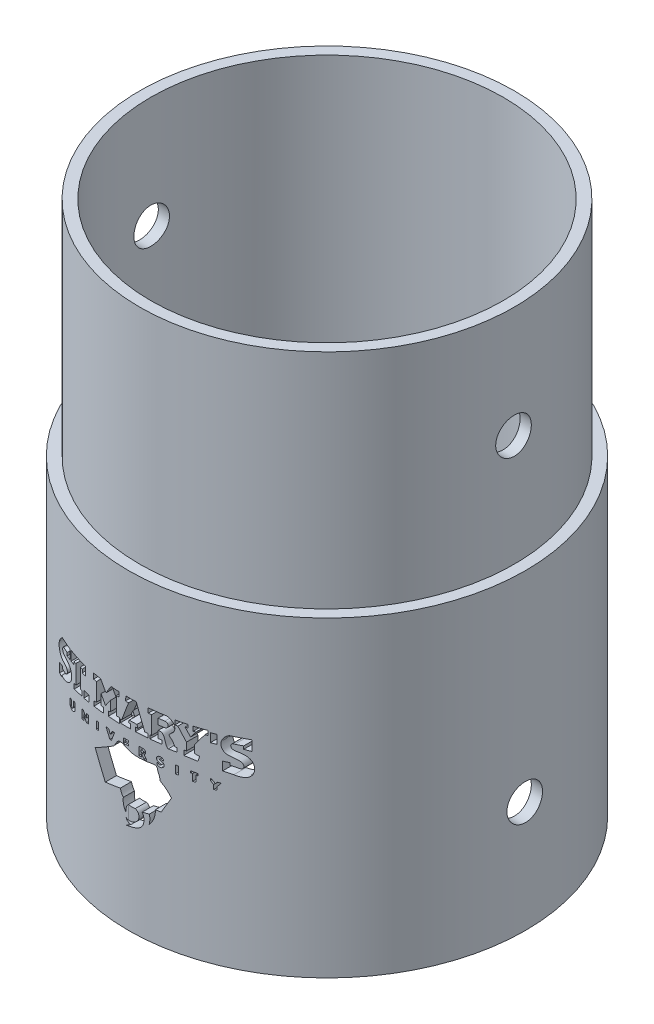
from build123d import *

# Parameters (mm, degrees)
SKETCH1_R               = 34
BOSS_EXTRUDE1_DEPTH     = 10
SKETCH2_R               = 19.7871926
SKETCH2_R_2             = 2
CUT_EXTRUDE1_DEPTH      = 10
SKETCH3_R               = 4.837531333
SKETCH4_W               = 4.837531333
SKETCH4_H               = 4.837531333
CUT_EXTRUDE3_DEPTH      = 38
CUT_EXTRUDE3_DEPTH_BACK = 38
SKETCH5_W               = 72.361656805
SKETCH5_H               = 8.896778435
BOSS_EXTRUDE2_START     = 60
SKETCH6_R               = 22.2871926
SKETCH6_R_2             = 19.7871926
BOSS_EXTRUDE2_DEPTH     = 60
SKETCH7_R               = 21.0371926
SKETCH7_R_2             = 19.7871926
CUT_EXTRUDE4_DEPTH      = 25
CUT_EXTRUDE6_DEPTH      = 25
CUT_EXTRUDE6_DEPTH_BACK = 25
SKETCH8_R               = 2
CUT_EXTRUDE7_DEPTH      = 43
CUT_EXTRUDE7_DEPTH_BACK = 53
SKETCH9_W               = 69.351432881
SKETCH9_H               = 5.737807944
CUT_EXTRUDE8_START      = -25
SKETCH10_R              = 22.2871926
SKETCH10_R_2            = 21.0371926
CUT_EXTRUDE8_DEPTH      = 25
CUT_EXTRUDE9_DEPTH      = 30
CUT_EXTRUDE9_DEPTH_BACK = 30
SKETCH11_R              = 2
SKETCH13_W              = 0.263768511
SKETCH13_H              = 0.832043755
SKETCH13_W_2            = 0.284163404
SKETCH13_H_2            = 0.878419158
SKETCH13_W_3            = 0.554118638
SKETCH13_H_3            = 0.980849503
CUT_EXTRUDE10_DEPTH     = 10


with BuildPart() as part:
    # Sketch1 → Boss-Extrude1 (new body)
    with BuildSketch(Plane(origin=(0, 0, 0), x_dir=(1, 0, 0), z_dir=(0, 1, 0))):
        Circle(SKETCH1_R)
    extrude(amount=BOSS_EXTRUDE1_DEPTH)

    # Sketch2 → Cut-Extrude1 (cut)
    with BuildSketch(Plane.XZ):
        Circle(SKETCH2_R)
        with Locations((-22.1, 12.5)):
            Circle(SKETCH2_R_2)
        with Locations((22.1, 12.5)):
            Circle(SKETCH2_R_2)
        with Locations((22.1, -12.5)):
            Circle(SKETCH2_R_2)
        with Locations((-22.1, -12.5)):
            Circle(SKETCH2_R_2)
    extrude(amount=-CUT_EXTRUDE1_DEPTH, mode=Mode.SUBTRACT)

    # Sketch3 → Cut-Revolve1 (revolve, cut)
    with BuildSketch(Plane(origin=(0, 0, 0), x_dir=(0, 0, -1), z_dir=(1, 0, 0))):
        with Locations((-34, 5)):
            Circle(SKETCH3_R)
    revolve(axis=Axis((0, 0, 0), (0, 1, 0)), mode=Mode.SUBTRACT)

    # Sketch4 → Cut-Revolve2 (revolve, cut)
    with BuildSketch(Plane(origin=(0, 0, 0), x_dir=(0, 0, -1), z_dir=(1, 0, 0))):
        with Locations((-31.581234333, 2.581234333)):
            Rectangle(SKETCH4_W, SKETCH4_H)
    revolve(axis=Axis((0, 0, 0), (0, 1, 0)), mode=Mode.SUBTRACT)

    # Sketch5 → Cut-Extrude3 (cut, two sides: drawn at the far end of the back side and taken through both)
    with BuildSketch(Plane(origin=(0, 0, 0), x_dir=(0, 0, -1), z_dir=(1, 0, 0)).offset(-CUT_EXTRUDE3_DEPTH_BACK)):
        with Locations((-0.901301775, 0.551610782)):
            Rectangle(SKETCH5_W, SKETCH5_H)
    extrude(amount=CUT_EXTRUDE3_DEPTH + CUT_EXTRUDE3_DEPTH_BACK, mode=Mode.SUBTRACT)

    # Sketch6 → Boss-Extrude2 (add)
    with BuildSketch(Plane.XZ.offset(-5).offset(BOSS_EXTRUDE2_START)):
        Circle(SKETCH6_R)
        Circle(SKETCH6_R_2, mode=Mode.SUBTRACT)
    extrude(amount=-BOSS_EXTRUDE2_DEPTH)

    # Sketch7 → Cut-Extrude4 (cut)
    with BuildSketch(Plane.XZ.offset(55)):
        Circle(SKETCH7_R)
        Circle(SKETCH7_R_2, mode=Mode.SUBTRACT)
    extrude(amount=-CUT_EXTRUDE4_DEPTH, mode=Mode.SUBTRACT)

    # Sketch8 → Cut-Extrude6 (cut, two sides: drawn at the far end of the back side and taken through both)
    with BuildSketch(Plane(origin=(0, 0, 0), x_dir=(0, 0, -1), z_dir=(1, 0, 0)).offset(-CUT_EXTRUDE6_DEPTH_BACK)):
        with Locations((0, -42.5)):
            Circle(SKETCH8_R)
    extrude(amount=CUT_EXTRUDE6_DEPTH + CUT_EXTRUDE6_DEPTH_BACK, mode=Mode.SUBTRACT)

    # Sketch9 → Cut-Extrude7 (cut, two sides: drawn at the far end of the back side and taken through both)
    with BuildSketch(Plane(origin=(0, 0, 0), x_dir=(0, 0, -1), z_dir=(1, 0, 0)).offset(-CUT_EXTRUDE7_DEPTH_BACK)):
        with Locations((0.165912519, 7.868903972)):
            Rectangle(SKETCH9_W, SKETCH9_H)
    extrude(amount=CUT_EXTRUDE7_DEPTH + CUT_EXTRUDE7_DEPTH_BACK, mode=Mode.SUBTRACT)

    # Sketch10 → Cut-Extrude8 (cut)
    with BuildSketch(Plane(origin=(0, 5, 0), x_dir=(1, 0, 0), z_dir=(0, 1, 0)).offset(CUT_EXTRUDE8_START)):
        Circle(SKETCH10_R)
        Circle(SKETCH10_R_2, mode=Mode.SUBTRACT)
    extrude(amount=CUT_EXTRUDE8_DEPTH, mode=Mode.SUBTRACT)

    # Sketch11 → Cut-Extrude9 (cut, two sides: drawn at the far end of the back side and taken through both)
    with BuildSketch(Plane(origin=(0, 0, 0), x_dir=(0, 0, -1), z_dir=(1, 0, 0)).offset(-CUT_EXTRUDE9_DEPTH_BACK)):
        with Locations((0, -7.5)):
            Circle(SKETCH11_R)
    extrude(amount=CUT_EXTRUDE9_DEPTH + CUT_EXTRUDE9_DEPTH_BACK, mode=Mode.SUBTRACT)

    # Sketch13 → Cut-Extrude10 (cut)
    # profile 1 of 20: a face of its own
    with BuildSketch(Plane.XY.offset(22.2871926)):
        with BuildLine():
            Line((2.836361609, -41.920982841), (3.402422545, -41.91240616))
            Line((3.402422545, -41.91240616), (4.388740843, -40.154186586))
            add(Edge.make_bspline(
                [(4.388740843, -40.154186586), (3.953248153, -39.424133031), (3.282349013, -38.901991183)],
                knots=[0, 0, 0, 1, 1, 1], degree=2))
            add(Edge.make_bspline(
                [(3.282349013, -38.901991183), (3.278682525, -38.462975575), (3.071517485, -38.069687572)],
                knots=[0, 0, 0, 1, 1, 1], degree=2))
            add(Edge.make_bspline(
                [(-1.818298439, -38.006885508), (-1.548063892, -37.870643869), (-1.380953645, -37.081194053), (-0.679356744, -37.120843751), (-0.264912136, -37.339278705), (0.406742784, -37.598482622), (1.294786113, -37.673169888), (2.272663425, -37.634020046), (3.079278305, -37.482676425), (3.071517485, -38.069687572)],
                knots=[0, 0, 0, 0, 0.207613915, 0.255303168, 0.349193661, 0.455828664, 0.635269324, 0.809737725, 1, 1, 1, 1], degree=3))
            add(Edge.make_bspline(
                [(-4.122918881, -39.477452838), (-2.967006362, -38.747814904), (-1.818298439, -38.006885508)],
                knots=[0, 0, 0, 1, 1, 1], degree=2))
            Line((-4.122918881, -39.477452838), (-2.784044148, -42.045458474))
            Line((-2.784044148, -42.045458474), (-0.940347794, -41.628431918))
            add(Edge.make_bspline(
                [(-0.940347794, -41.628431918), (-0.819931819, -42.073859012), (-0.591539569, -42.349081415)],
                knots=[0, 0, 0, 0.333862906, 0.333862906, 0.333862906], degree=2))
            add(Edge.make_bspline(
                [(-0.591539569, -42.349081415), (-0.690661576, -43.074522796), (-0.28188481, -43.644895691)],
                knots=[0, 0, 0, 1, 1, 1], degree=2))
            add(Edge.make_bspline(
                [(0.001826697, -42.737888696), (-0.384406173, -43.126300945), (-0.28188481, -43.644895691)],
                knots=[0, 0, 0, 1, 1, 1], degree=2))
            add(Edge.make_bspline(
                [(0.001826697, -42.737888696), (0.326733886, -42.831120176), (0.749707197, -42.769767756)],
                knots=[0.681826442, 0.681826442, 0.681826442, 1, 1, 1], degree=2))
            add(Edge.make_bspline(
                [(0.749707197, -42.769767756), (1.271104248, -43.027328851), (1.195747805, -43.825293152), (0.416905383, -44.29959265), (-0.043033159, -44.290900484), (-0.28188481, -44.145481691)],
                knots=[0, 0, 0, 0, 0.500944797, 0.699688043, 1, 1, 1, 1], degree=3))
            add(Edge.make_bspline(
                [(-0.28188481, -44.145481691), (-0.107271874, -44.518653759), (0.284429083, -44.54759516)],
                knots=[0, 0, 0, 1, 1, 1], degree=2))
            add(Edge.make_bspline(
                [(0.284429083, -44.54759516), (0.001576931, -44.722339623), (-0.28188481, -44.896093499)],
                knots=[0, 0, 0, 1, 1, 1], degree=2))
            add(Edge.make_bspline(
                [(-0.28188481, -44.896093499), (0.248184768, -44.7593563), (1.703383303, -44.62885333), (1.756900471, -43.176386467), (1.481246036, -42.769767756)],
                knots=[0, 0, 0, 0, 0.551984151, 1, 1, 1, 1], degree=3))
            Line((1.481246036, -42.769767756), (2.227417269, -42.616126394))
            add(Edge.make_bspline(
                [(2.227417269, -42.616126394), (2.34194184, -43.131829254), (2.201687227, -43.644895691)],
                knots=[0, 0, 0, 1, 1, 1], degree=2))
            add(Edge.make_bspline(
                [(2.836361609, -41.920982841), (2.85849956, -42.909529006), (2.201687227, -43.644895691)],
                knots=[0, 0, 0, 1, 1, 1], degree=2))
        make_face()
    # profile 2 of 20: a face of its own
    with BuildSketch(Plane.XY.offset(22.2871926)):
        with BuildLine():
            add(Edge.make_bspline(
                [(-8.050906857, -37.883629276), (-7.641193205, -38.401338737), (-7.206196559, -37.864857937)],
                knots=[0, 0, 0, 1, 1, 1], degree=2))
            Line((-7.206196559, -37.864857937), (-7.206196559, -37.038918979))
            Line((-7.206196559, -37.038918979), (-7.497152328, -37.038918979))
            Line((-7.497152328, -37.038918979), (-7.497152328, -37.705301547))
            add(Edge.make_bspline(
                [(-7.806879437, -37.789772577), (-7.758291287, -37.835788185), (-7.639163377, -37.948608764), (-7.549967999, -37.79579052), (-7.497152328, -37.705301547)],
                knots=[0, 0, 0, 0, 0.407865383, 1, 1, 1, 1], degree=3))
            Line((-7.806879437, -37.789772577), (-7.806879437, -37.170318358))
            Line((-7.806879437, -37.170318358), (-8.050906857, -37.170318358))
            Line((-8.050906857, -37.170318358), (-8.050906857, -37.883629276))
        make_face()
    # profile 3 of 20: a face of its own
    with BuildSketch(Plane.XY.offset(22.2871926)):
        Polygon((-6.079916161, -36.879362589), (-6.079916161, -37.864857937), (-5.767842635, -37.864857937), (-5.767842635, -37.266521475), (-5.380683748, -37.789772577), (-5.056878134, -37.789772577), (-5.056878134, -36.879362589), (-5.380683748, -36.879362589), (-5.380683748, -37.372110263), (-5.873431422, -36.879362589), align=None)
    # profile 4 of 20: a face of its own
    with BuildSketch(Plane.XY.offset(22.2871926)):
        with Locations((-3.821428356, -37.149667829)):
            Rectangle(SKETCH13_W, SKETCH13_H)
    # profile 5 of 20: a face of its own
    with BuildSketch(Plane.XY.offset(22.2871926)):
        Polygon((-2.348842872, -36.605313859), (-2.689699116, -36.605313859), (-2.197351208, -37.565689706), (-2.019348503, -37.565689706), (-1.621682884, -36.605313859), (-1.89436788, -36.605313859), (-2.144329125, -37.038918979), align=None)
    # profile 6 of 20: a face of its own
    with BuildSketch(Plane.XY.offset(22.2871926)):
        with Locations((4.902216724, -37.213466615)):
            Rectangle(SKETCH13_W_2, SKETCH13_H_2)
    # profile 7 of 20: a face of its own
    with BuildSketch(Plane.XY.offset(22.2871926)):
        with BuildLine():
            Line((1.139601724, -36.529568027), (1.139601724, -37.433556648))
            Line((1.139601724, -37.433556648), (1.427604429, -37.433556648))
            Line((1.427604429, -37.433556648), (1.427604429, -37.170318358))
            Line((1.427604429, -37.170318358), (1.673260811, -37.528147026))
            Line((1.673260811, -37.528147026), (1.97714543, -37.528147026))
            Line((1.97714543, -37.528147026), (1.673260811, -37.085501783))
            add(Edge.make_bspline(
                [(1.673260811, -36.529568027), (1.903549959, -36.742092525), (1.903549959, -36.927403777), (1.673260811, -37.085501783)],
                knots=[0, 0, 0, 0, 1, 1, 1, 1], degree=3))
            Line((1.673260811, -36.529568027), (1.139601724, -36.529568027))
        make_face()
        with BuildLine():
            Line((1.380366389, -36.984468142), (1.380366389, -36.774257036))
            ThreePointArc((1.380366389, -36.774257036), (1.626930216, -36.879362589), (1.380366389, -36.984468142))
        make_face(mode=Mode.SUBTRACT)
    # profile 8 of 20: a face of its own
    with BuildSketch(Plane.XY.offset(22.2871926)):
        Polygon((6.115693792, -37.038918979), (6.287513319, -37.038918979), (6.287513319, -37.789772577), (6.564572639, -37.789772577), (6.564572639, -37.106001966), (6.749278851, -37.106001966), (6.749278851, -36.879362589), (6.115693792, -36.835706407), align=None)
    # profile 9 of 20: a face of its own
    with BuildSketch(Plane.XY.offset(22.2871926)):
        Polygon((7.779371191, -37.038918979), (7.779371191, -37.213466615), (8.05643051, -37.528147026), (8.05643051, -38.006885508), (8.333489829, -38.006885508), (8.333489829, -37.652676194), (8.667381829, -37.213466615), (8.333489829, -37.213466615), (8.19496017, -37.395691866), (7.88084067, -37.038918979), align=None)
    # profile 10 of 20: a face of its own
    with BuildSketch(Plane.XY.offset(22.2871926)):
        with BuildLine():
            Line((-8.939114046, -35.414269684), (-9.606535515, -35.414269684))
            Line((-9.606535515, -35.414269684), (-9.606535515, -35.157000265))
            Line((-9.606535515, -35.157000265), (-10.221123573, -35.285634975))
            Line((-10.221123573, -35.285634975), (-10.221123573, -36.295689696))
            Line((-10.221123573, -36.295689696), (-9.68896097, -36.295689696))
            Line((-9.68896097, -36.295689696), (-9.68896097, -36.128906961))
            add(Edge.make_bspline(
                [(-9.272824781, -33.141723146), (-9.56250197, -33.149159868), (-9.608361443, -33.788392595), (-8.77884035, -33.880005707), (-7.952347308, -34.105710713), (-7.501463714, -35.732501205), (-9.055781756, -36.32407908), (-9.68896097, -36.128906961)],
                knots=[0, 0, 0, 0, 0.121852497, 0.225225517, 0.406479529, 0.579433197, 1, 1, 1, 1], degree=3))
            Line((-9.272824781, -33.141723146), (-8.620336074, -33.141723146))
            Line((-8.620336074, -33.141723146), (-8.620336074, -33.470456293))
            Line((-8.620336074, -33.470456293), (-8.050906857, -33.470456293))
            Line((-8.050906857, -33.470456293), (-8.050906857, -32.412793125))
            Line((-8.050906857, -32.412793125), (-9.606535515, -32.412793125))
            add(Edge.make_bspline(
                [(-8.939114046, -35.414269684), (-8.66631953, -35.412384758), (-8.407437021, -34.750580685), (-9.163106773, -34.561244661), (-9.866303575, -34.565229514), (-10.705382691, -33.511289951), (-9.937097189, -32.686070138), (-9.606535515, -32.412793125)],
                knots=[0, 0, 0, 0, 0.163024053, 0.300623513, 0.421053766, 0.661028375, 1, 1, 1, 1], degree=3))
        make_face()
    # profile 11 of 20: a face of its own
    with BuildSketch(Plane.XY.offset(22.2871926)):
        Polygon((-7.889095842, -32.412793125), (-7.889095842, -33.470456293), (-7.3703865, -33.470456293), (-7.3703865, -33.141723146), (-7.069430658, -33.141723146), (-7.069430658, -35.24875628), (-7.353008336, -35.285634975), (-7.353008336, -35.823575899), (-6.079916161, -35.658012878), (-6.079916161, -35.157000265), (-6.329829415, -35.157000265), (-6.329829415, -33.001809383), (-6.021713836, -33.001809383), (-6.021713836, -33.367339478), (-5.491431982, -33.367339478), (-5.491431982, -32.412793125), align=None)
    # profile 12 of 20: a face of its own
    with BuildSketch(Plane.XY.offset(22.2871926)):
        Polygon((-5.767842635, -34.912719163), (-5.767842635, -35.658012878), (-4.990079732, -35.605319222), (-4.990079732, -34.912719163), align=None)
    # profile 13 of 20: a face of its own
    with BuildSketch(Plane.XY.offset(22.2871926)):
        Polygon((-4.302768015, -35.036719072), (-4.302768015, -35.535948638), (-3.016081455, -35.478443094), (-3.016081455, -34.912719163), (-3.328767853, -34.912719163), (-3.328767853, -33.746088563), (-2.757306504, -34.587107153), (-2.144329125, -33.746088563), (-2.144329125, -34.8494762), (-2.390708657, -34.912719163), (-2.390708657, -35.414269684), (-1.047567168, -35.414269684), (-1.047567168, -34.83442724), (-1.39325611, -34.83442724), (-1.39325611, -32.859300381), (-1.080194064, -32.859300381), (-1.080194064, -32.337371064), (-2.05473396, -32.337371064), (-2.689699116, -33.311849549), (-3.392177834, -32.337371064), (-4.350407438, -32.337371064), (-4.350407438, -32.940851836), (-3.953312611, -32.940851836), (-3.953312611, -34.947017647), align=None)
    # profile 14 of 20: a face of its own
    with BuildSketch(Plane.XY.offset(22.2871926)):
        Polygon((-0.940347794, -35.285634975), (0.201547163, -35.285634975), (0.201547163, -34.778747715), (-0.025942718, -34.778747715), (0.08000573, -34.503307323), (0.922493003, -34.503307323), (1.042279231, -34.83442724), (0.749707197, -34.83442724), (0.749707197, -35.285634975), (2.112847999, -35.285634975), (2.112847999, -34.83442724), (1.754080178, -34.83442724), (0.850742976, -32.337371064), (-0.28188481, -32.337371064), (-0.356727489, -32.859300381), (0.001826961, -32.859300381), (-0.777637265, -34.885719231), (-0.940347794, -34.912719163), align=None)
        Polygon((0.484711057, -33.367339478), (0.68499303, -33.872509806), (0.284429083, -33.872509806), align=None, mode=Mode.SUBTRACT)
    # profile 15 of 20: a face of its own
    with BuildSketch(Plane.XY.offset(22.2871926)):
        with BuildLine():
            Line((2.278877354, -35.285634975), (3.464246591, -35.285634975))
            Line((3.464246591, -35.285634975), (3.464246591, -34.885719231))
            Line((3.464246591, -34.885719231), (3.096110574, -34.885719231))
            Line((3.096110574, -34.885719231), (3.096110574, -34.106772289))
            add(Edge.make_bspline(
                [(4.082866911, -35.478443094), (3.687777242, -35.31220779), (3.878155467, -33.90041228), (3.096110574, -34.106772289)],
                knots=[0, 0, 0, 0, 1, 1, 1, 1], degree=3))
            Line((4.082866911, -35.478443094), (4.919904135, -35.478443094))
            Line((4.919904135, -35.478443094), (4.919904135, -35.036719072))
            Line((4.919904135, -35.036719072), (4.696141709, -35.036719072))
            add(Edge.make_bspline(
                [(4.696141709, -35.036719072), (4.625492015, -34.831539833), (4.514054357, -34.507905113), (4.005812772, -34.068394956), (4.562403754, -33.771785083), (4.756253665, -33.294541123), (4.584856099, -32.659413859), (4.188503908, -32.452877541), (3.966841949, -32.337371064)],
                knots=[0, 0, 0, 0, 0.20436504, 0.322350463, 0.469542898, 0.613052072, 0.783597422, 1, 1, 1, 1], degree=3))
            Line((3.966841949, -32.337371064), (2.112847999, -32.337371064))
            Line((2.112847999, -32.337371064), (2.112847999, -32.859300381))
            Line((2.112847999, -32.859300381), (2.441942451, -32.859300381))
            Line((2.441942451, -32.859300381), (2.441942451, -34.885719231))
            Line((2.441942451, -34.885719231), (2.278877354, -34.885719231))
            Line((2.278877354, -34.885719231), (2.278877354, -35.285634975))
        make_face()
        with BuildLine():
            Line((3.760522047, -33.556286854), (3.096110574, -33.556286854))
            Line((3.096110574, -33.556286854), (3.096110574, -32.911212463))
            Line((3.096110574, -32.911212463), (3.760522047, -32.911212463))
            ThreePointArc((3.760522047, -32.911212463), (4.083059242, -33.233749658), (3.760522047, -33.556286854))
        make_face(mode=Mode.SUBTRACT)
    # profile 16 of 20: a face of its own
    with BuildSketch(Plane.XY.offset(22.2871926)):
        Polygon((5.878507356, -32.412793124), (4.696141709, -32.412793124), (4.696141709, -32.911212463), (4.976544048, -32.911212463), (5.754200848, -34.179170856), (5.754200848, -35.036719072), (5.512584562, -35.036719072), (5.512584562, -35.55931612), (6.749278851, -35.686004373), (6.893511117, -35.157000265), (6.452352927, -35.036719072), (6.452352927, -34.179170856), (7.334669306, -32.911212463), (7.595121037, -32.911212463), (7.595121037, -32.412793124), (6.340133215, -32.412793124), (6.340133215, -32.911212463), (6.564572639, -32.911212463), (6.115693792, -33.556286854), (5.62989434, -32.764197732), (5.878507356, -32.764197732), align=None)
    # profile 17 of 20: a face of its own
    with BuildSketch(Plane.XY.offset(22.2871926)):
        with Locations((8.05643051, -33.054766908)):
            Rectangle(SKETCH13_W_3, SKETCH13_H_3)
    # profile 18 of 20: a face of its own
    with BuildSketch(Plane.XY.offset(22.2871926)):
        with BuildLine():
            Line((9.33588725, -35.036719072), (8.762166623, -35.036719072))
            Line((8.762166623, -35.036719072), (8.77491597, -35.986908543))
            Line((8.77491597, -35.986908543), (9.627902207, -36.128906961))
            add(Edge.make_bspline(
                [(9.695345405, -33.141723146), (9.39602668, -33.062710403), (9.300985983, -33.741493769), (10.198213449, -33.838143392), (10.983212725, -34.292827109), (11.29037786, -35.259093651), (10.838212378, -36.321005206), (9.968066329, -36.222986548), (9.627902207, -36.128906961)],
                knots=[0, 0, 0, 0, 0.112519879, 0.251894864, 0.422201346, 0.623587799, 0.768430808, 1, 1, 1, 1], degree=3))
            Line((9.695345405, -33.141723146), (10.37065132, -33.141723146))
            Line((10.37065132, -33.141723146), (10.37065132, -33.470456293))
            Line((10.37065132, -33.470456293), (10.962586135, -33.545191659))
            Line((10.962586135, -33.545191659), (10.962586135, -32.412793124))
            Line((10.962586135, -32.412793124), (9.520266093, -32.412793124))
            add(Edge.make_bspline(
                [(9.520266093, -32.412793124), (9.277243658, -32.365591852), (8.896453169, -32.617459371), (8.624894729, -33.140523681), (8.62466326, -33.698121117), (8.908396978, -34.217481492), (9.48678807, -34.468344956), (10.045353853, -34.588887204), (10.411865783, -34.961982183), (10.381681886, -35.450477728), (10.082738818, -35.42356134), (9.915945448, -35.383860021)],
                knots=[0.144200399, 0.144200399, 0.144200399, 0.144200399, 0.277346197, 0.370102525, 0.46871268, 0.579012334, 0.679582974, 0.811820653, 0.895290921, 0.956706672, 1.025789329, 1.025789329, 1.025789329, 1.025789329], degree=3))
            Line((9.915945448, -35.383860021), (9.33588725, -35.285634975))
            add(Edge.make_bspline(
                [(9.33588725, -35.285634975), (9.33459367, -35.276823915), (9.33588725, -35.270013488)],
                knots=[0, 0, 0, 0.006190799, 0.006190799, 0.006190799], degree=2))
            Line((9.33588725, -35.270013488), (9.33588725, -35.036719072))
        make_face()
    # profile 19 of 20: a face of its own
    with BuildSketch(Plane.XY.offset(22.2871926)):
        Polygon((-0.591539569, -36.529568027), (-0.591539569, -37.12791007), (-0.356727489, -37.12791007), (-0.356727489, -37.05026937), (-0.025942718, -37.05026937), (-0.025942718, -36.877121217), (-0.384497169, -36.877121217), (-0.384497169, -36.713756172), (-0.021240424, -36.713756172), (-0.021240424, -36.529568027), align=None)
    # profile 20 of 20: a face of its own
    with BuildSketch(Plane.XY.offset(22.2871926)):
        with BuildLine():
            add(Edge.make_bspline(
                [(3.07155811, -37.248044511), (3.015826539, -37.26187695), (2.918408178, -37.351309252), (3.12163901, -37.586065438), (3.379128965, -37.63032159), (3.605194919, -37.514242325), (3.709695591, -37.298501551), (3.655257879, -37.04842524), (3.447943257, -36.996782027), (3.179791674, -36.899071707), (3.347721898, -36.729436533), (3.475629742, -36.888518458), (3.671550125, -36.854083201), (3.605825544, -36.733645951)],
                knots=[0.007346389, 0.007346389, 0.007346389, 0.007346389, 0.060831012, 0.192423244, 0.280822126, 0.405186076, 0.487492921, 0.584598932, 0.684829509, 0.779546256, 0.83080703, 0.89388498, 1, 1, 1, 1], degree=3))
            add(Edge.make_bspline(
                [(3.605825544, -36.733645951), (3.503155336, -36.512669245), (2.956030434, -36.504471572), (2.935809959, -37.047920825), (3.263136254, -37.147041723), (3.5192868, -37.354420775), (3.248763262, -37.395691866)],
                knots=[0, 0, 0, 0, 0.415187549, 0.575786917, 0.771495741, 1, 1, 1, 1], degree=3))
            add(Edge.make_bspline(
                [(3.248763262, -37.395691866), (3.165679146, -37.378379499), (3.151476512, -37.263963557), (3.07155811, -37.248044511)],
                knots=[0, 0, 0, 0, 1, 1, 1, 1], degree=3))
        make_face()
    extrude(amount=-CUT_EXTRUDE10_DEPTH, mode=Mode.SUBTRACT)


with BuildPart() as cut_extrude10_piece_1:
    # of the separate pieces the step leaves, piece 1, a body of its own (cut_extrude10_pieces)
    add(part.part.solids().sort_by_distance((22.2871926, -55, 0))[0])


with BuildPart() as cut_extrude10_piece_2:
    # of the separate pieces the step leaves, piece 2, a body of its own (cut_extrude10_pieces)
    add(part.part.solids().sort_by_distance((3.760522047, -33.556286854, 21.967645025))[0])


with BuildPart() as cut_extrude10_piece_3:
    # of the separate pieces the step leaves, piece 3, a body of its own (cut_extrude10_pieces)
    add(part.part.solids().sort_by_distance((0.68499303, -33.872509806, 22.276663541))[0])


with BuildPart() as cut_extrude10_piece_4:
    # of the separate pieces the step leaves, piece 4, a body of its own (cut_extrude10_pieces)
    add(part.part.solids().sort_by_distance((1.380366389, -36.774257036, 22.244404749))[0])


solid = Compound([cut_extrude10_piece_1.part, cut_extrude10_piece_2.part, cut_extrude10_piece_3.part, cut_extrude10_piece_4.part])
